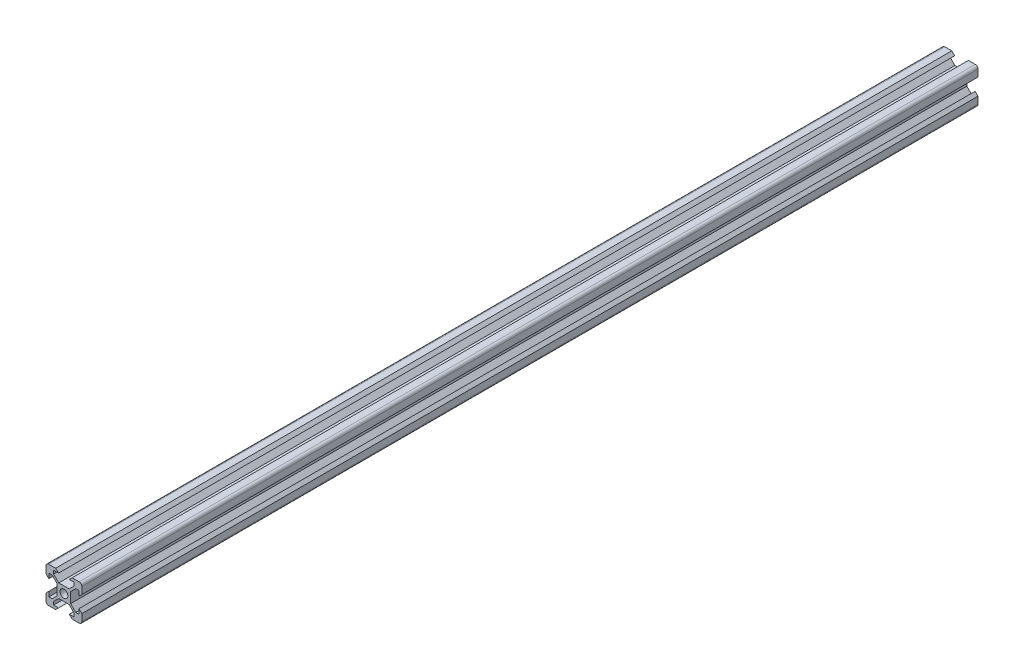
from build123d import *

# Parameters (mm, degrees)
SKETCH1_R           = 4.4
BOSS_EXTRUDE1_DEPTH = 500


with BuildPart() as part:
    # Sketch1 → Boss-Extrude1 (new, symmetric)
    with BuildSketch(Plane.XY):
        with BuildLine():
            Line((-13.271281672, 11.512), (-7.544, 5.784718328))
            Line((-7.544, 5.784718328), (-7.544, -5.784718328))
            Line((-7.544, -5.784718328), (-13.271281672, -11.512))
            Line((-13.271281672, -11.512), (-16.8, -11.512))
            Line((-16.8, -11.512), (-16.8, -6.051976926))
            Line((-16.8, -6.051976926), (-20, -9.251976926))
            Line((-20, -9.251976926), (-20, -17))
            ThreePointArc((-20, -17), (-19.121320344, -19.121320344), (-17, -20))
            Line((-17, -20), (-9.251976926, -20))
            Line((-9.251976926, -20), (-6.051976926, -16.8))
            Line((-6.051976926, -16.8), (-11.512, -16.8))
            Line((-11.512, -16.8), (-11.512, -13.271281672))
            Line((-11.512, -13.271281672), (-5.784718328, -7.544))
            Line((-5.784718328, -7.544), (5.784718328, -7.544))
            Line((5.784718328, -7.544), (11.512, -13.271281672))
            Line((11.512, -13.271281672), (11.512, -16.8))
            Line((11.512, -16.8), (6.051976926, -16.8))
            Line((6.051976926, -16.8), (9.251976926, -20))
            Line((9.251976926, -20), (17, -20))
            ThreePointArc((17, -20), (19.121320344, -19.121320344), (20, -17))
            Line((20, -17), (20, -9.251976926))
            Line((20, -9.251976926), (16.8, -6.051976926))
            Line((16.8, -6.051976926), (16.8, -11.512))
            Line((16.8, -11.512), (13.271281672, -11.512))
            Line((13.271281672, -11.512), (7.544, -5.784718328))
            Line((7.544, -5.784718328), (7.544, 5.784718328))
            Line((7.544, 5.784718328), (13.271281672, 11.512))
            Line((13.271281672, 11.512), (16.8, 11.512))
            Line((16.8, 11.512), (16.8, 6.051976926))
            Line((16.8, 6.051976926), (20, 9.251976926))
            Line((20, 9.251976926), (20, 17))
            ThreePointArc((20, 17), (19.121320344, 19.121320344), (17, 20))
            Line((17, 20), (9.251976926, 20))
            Line((9.251976926, 20), (6.051976926, 16.8))
            Line((6.051976926, 16.8), (11.512, 16.8))
            Line((11.512, 16.8), (11.512, 13.271281672))
            Line((11.512, 13.271281672), (5.784718328, 7.544))
            Line((5.784718328, 7.544), (-5.784718328, 7.544))
            Line((-5.784718328, 7.544), (-11.512, 13.271281672))
            Line((-11.512, 13.271281672), (-11.512, 16.8))
            Line((-11.512, 16.8), (-6.051976926, 16.8))
            Line((-6.051976926, 16.8), (-9.251976926, 20))
            Line((-9.251976926, 20), (-17, 20))
            ThreePointArc((-17, 20), (-19.121320344, 19.121320344), (-20, 17))
            Line((-20, 17), (-20, 9.251976926))
            Line((-20, 9.251976926), (-16.8, 6.051976926))
            Line((-16.8, 6.051976926), (-16.8, 11.512))
            Line((-16.8, 11.512), (-13.271281672, 11.512))
        make_face()
        Circle(SKETCH1_R, mode=Mode.SUBTRACT)
    extrude(amount=BOSS_EXTRUDE1_DEPTH, both=True)


solid = part.part
